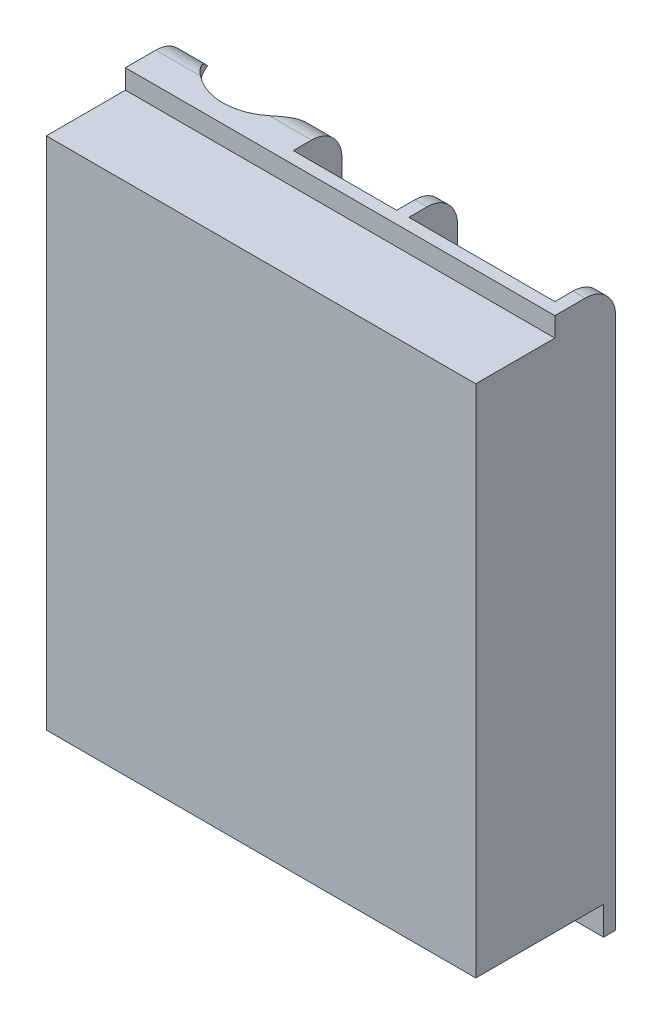
from build123d import *

# Parameters (mm, degrees)
SKETCH_1_W          = 70.6
SKETCH_1_H          = 84.6
EXTRUDE_1_DEPTH     = 23
SKETCH_2_W          = 18
SKETCH_2_H          = 4.7
EXTRUDE_2_DEPTH     = 2
SKETCH_3_W          = 70.6
SKETCH_3_H          = 3.2
EXTRUDE_5_DEPTH     = 10
CUT_EXTRUDE_START   = -2
SKETCH_4_R          = 11
CUT_EXTRUDE_1_DEPTH = 115.979827321
EXTRUDE_START       = -2
EXTRUDE_1_2_DEPTH   = 2
DELETE_START        = 91
DELETE_FACE_1_DEPTH = 2
CUT_EXTRUDE_2_DEPTH = 43
EXTRUDE_START_2     = 24
EXTRUDE_6_DEPTH     = 2
FILLET_1_R          = 5


# Read off the part's stored shape, not the designer's step: 删除面1
with BuildPart() as part:
    # 草图1 → Extrude 1 (new body)
    with BuildSketch(Plane.XY):
        with Locations((-38.5, 47.5)):
            Rectangle(SKETCH_1_W, SKETCH_1_H)
    extrude(amount=-EXTRUDE_1_DEPTH)

    # 草图2 → 凸台-拉伸2 (add)
    with BuildSketch(Plane(origin=(0, 0, -23), x_dir=(-1, 0, 0), z_dir=(0, 0, -1))):
        with Locations((12.2, 2.85)):
            Rectangle(SKETCH_2_W, SKETCH_2_H)
        with Locations((64.8, 2.85)):
            Rectangle(SKETCH_2_W, SKETCH_2_H)
    extrude(amount=-EXTRUDE_2_DEPTH)

    # 草图3 → 凸台-拉伸5 (add)
    with BuildSketch(Plane(origin=(0, 0, -23), x_dir=(-1, 0, 0), z_dir=(0, 0, -1))):
        with Locations((38.5, 91.4)):
            Rectangle(SKETCH_3_W, SKETCH_3_H)
    extrude(amount=-EXTRUDE_5_DEPTH)

    # 草图4 → 切除-拉伸1 (cut, through all)
    with BuildSketch(Plane.XZ.offset(-5.2).offset(CUT_EXTRUDE_START)):
        with Locations((-60.8, -25)):
            Circle(SKETCH_4_R)
    extrude(amount=-CUT_EXTRUDE_1_DEPTH, mode=Mode.SUBTRACT)

    # 草图5 → Extrude 1 2 (add)
    with BuildSketch(Plane(origin=(0, 93, 0), x_dir=(1, 0, 0), z_dir=(0, 1, 0)).offset(EXTRUDE_START)):
        with BuildLine():
            ThreePointArc((-71.616653826, 23), (-60.8, 14), (-49.983346174, 23))
            Line((-49.983346174, 23), (-51.950010506, 23.363636364))
            ThreePointArc((-51.950010506, 23.363636364), (-60.8, 16), (-69.649989494, 23.363636364))
            Line((-69.649989494, 23.363636364), (-71.616653826, 23))
        make_face()
    extrude(amount=EXTRUDE_1_2_DEPTH)

    # Delete Face 1 outline → Delete Face 1 (cut)
    with BuildSketch(Plane(origin=(0, 0, 0), x_dir=(1, 0, 0), z_dir=(0, 1, 0)).offset(DELETE_START)):
        with BuildLine():
            ThreePointArc((-51.950010506, 23.363636364), (-51.985647631, 23.181431245), (-52.025035613, 23))
            Line((-52.025035613, 23), (-49.983346174, 23))
            Line((-49.983346174, 23), (-51.950010506, 23.363636364))
        make_face()
        with BuildLine():
            Line((-69.649989494, 23.363636364), (-71.616653826, 23))
            Line((-71.616653826, 23), (-69.574964387, 23))
            ThreePointArc((-69.574964387, 23), (-69.614352369, 23.181431245), (-69.649989494, 23.363636364))
        make_face()
    extrude(amount=DELETE_FACE_1_DEPTH, mode=Mode.SUBTRACT)

    # 草图6 → 切除-拉伸2 (cut)
    with BuildSketch(Plane(origin=(-3.2, 0, 0), x_dir=(0, 0, -1), z_dir=(1, 0, 0)).offset(CUT_EXTRUDE_START)):
        Polygon((23, 93), (15, 93), (15, 87.8), (2, 87.8), (2, 7.2), (23, 7.2), align=None)
    extrude(amount=-CUT_EXTRUDE_2_DEPTH, mode=Mode.SUBTRACT)

    # 草图7 → 凸台-拉伸6 (add)
    with BuildSketch(Plane.ZY.offset(5.2).offset(EXTRUDE_START_2)):
        Polygon((-23, 93), (-23, 7.2), (-2, 7.2), (-2, 87.8), (-15, 87.8), (-15, 93), align=None)
    extrude(amount=EXTRUDE_6_DEPTH)

    # 圆角1
    fillet_1_edges = [part.edges().sort_by_distance(p)[0] for p in [
        (-71.687482193, 93, -23),
        (-50.112517807, 93, -23),
        (-30.2, 93, -23),
        (-4.2, 93, -23),
    ]]
    fillet(fillet_1_edges, radius=FILLET_1_R)


solid = part.part
